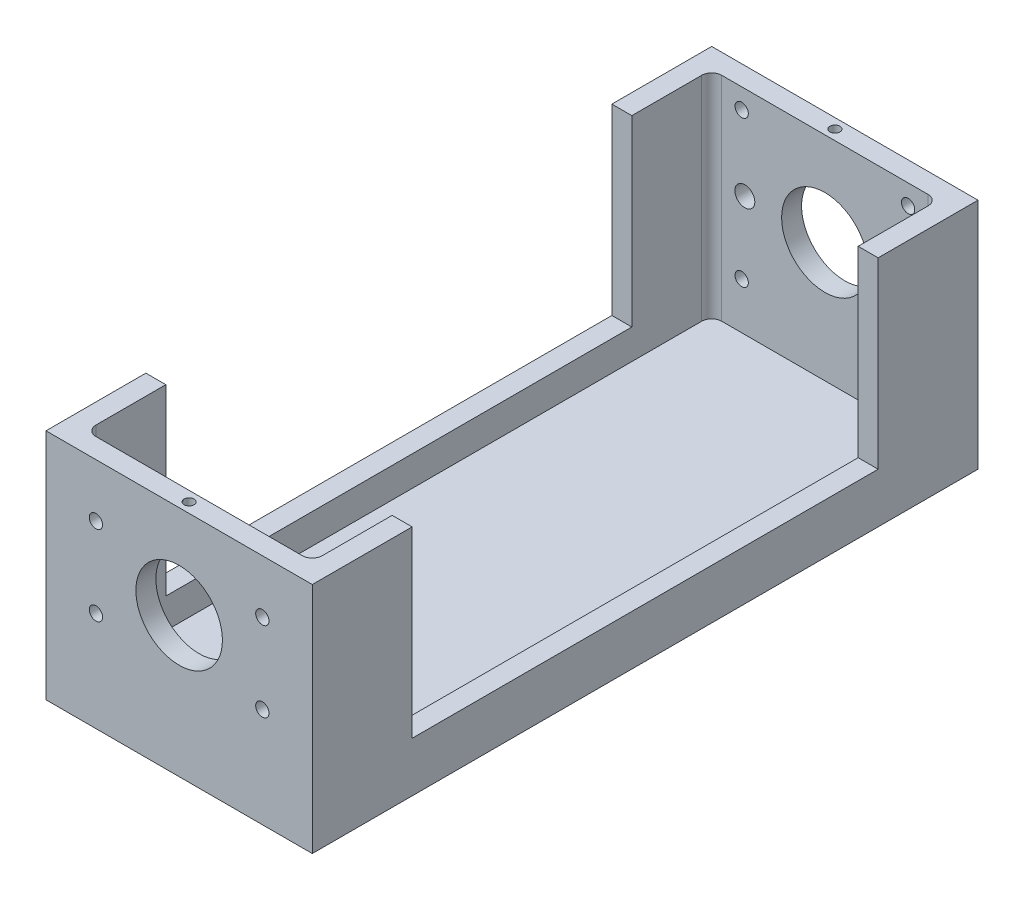
from build123d import *

# Parameters (mm, degrees)
SKETCH_1_W          = 80
SKETCH_1_H          = 70
EXTRUDE_1_DEPTH     = 200
CUT_EXTRUDE_1_DEPTH = 64
SKETCH_3_R          = 13
CUT_EXTRUDE_2_DEPTH = 207.942020866
SKETCH_4_R          = 2
SKETCH_4_W          = 27
SKETCH_4_H          = 36
CUT_EXTRUDE_3_DEPTH = 10
SKETCH_7_R          = 1.5
CUT_EXTRUDE_6_DEPTH = 10
SKETCH_8_W          = 140
SKETCH_8_H          = 55
CUT_EXTRUDE_7_DEPTH = 219.231528428
SKETCH_9_R          = 2
CUT_EXTRUDE_8_DEPTH = 6
SKETCH_10_R         = 3
SKETCH_10_R_2       = 2
CUT_EXTRUDE_9_DEPTH = 50


with BuildPart() as part:
    # 草图1 → 凸台-拉伸1 (new body)
    with BuildSketch(Plane.XY):
        Rectangle(SKETCH_1_W, SKETCH_1_H)
    extrude(amount=-EXTRUDE_1_DEPTH)

    # 草图2 → 切除-拉伸1 (cut)
    with BuildSketch(Plane(origin=(0, 35, 0), x_dir=(1, 0, 0), z_dir=(0, 1, 0))):
        with BuildLine():
            ThreePointArc((-31, 194), (-33.121320344, 193.121320344), (-34, 191))
            Line((-34, 191), (-34, 9))
            ThreePointArc((-34, 9), (-33.121320344, 6.878679656), (-31, 6))
            Line((-31, 6), (31, 6))
            ThreePointArc((31, 6), (33.121320344, 6.878679656), (34, 9))
            Line((34, 9), (34, 191))
            ThreePointArc((34, 191), (33.121320344, 193.121320344), (31, 194))
            Line((31, 194), (-31, 194))
        make_face()
    extrude(amount=-CUT_EXTRUDE_1_DEPTH, mode=Mode.SUBTRACT)

    # 草图3 → 切除-拉伸2 (cut, through all)
    with BuildSketch(Plane.XY):
        with Locations((0, 7)):
            Circle(SKETCH_3_R)
    extrude(amount=-CUT_EXTRUDE_2_DEPTH, mode=Mode.SUBTRACT)

    # 草图4 → 切除-拉伸3 (cut)
    with BuildSketch(Plane.ZY.offset(40)):
        with Locations((-121.5, 2)):
            Circle(SKETCH_4_R)
        with Locations((-121.5, 26)):
            Circle(SKETCH_4_R)
        with Locations((-158.5, 26)):
            Circle(SKETCH_4_R)
        with Locations((-158.5, 2)):
            Circle(SKETCH_4_R)
        with Locations((-140, 14)):
            Rectangle(SKETCH_4_W, SKETCH_4_H)
    extrude(amount=-CUT_EXTRUDE_3_DEPTH, mode=Mode.SUBTRACT)

    # 草图7 → 切除-拉伸6 (cut)
    with BuildSketch(Plane(origin=(0, 35, 0), x_dir=(1, 0, 0), z_dir=(0, 1, 0))):
        with Locations((-37, 150)):
            Circle(SKETCH_7_R)
        with Locations((-37, 50)):
            Circle(SKETCH_7_R)
        with Locations((37, 50)):
            Circle(SKETCH_7_R)
        with Locations((37, 150)):
            Circle(SKETCH_7_R)
        with Locations((0, 197)):
            Circle(SKETCH_7_R)
        with Locations((0, 3)):
            Circle(SKETCH_7_R)
    extrude(amount=-CUT_EXTRUDE_6_DEPTH, mode=Mode.SUBTRACT)

    # 草图8 → 切除-拉伸7 (cut, through all)
    with BuildSketch(Plane(origin=(40, 0, 0), x_dir=(0, 0, -1), z_dir=(1, 0, 0))):
        with Locations((100, 7.5)):
            Rectangle(SKETCH_8_W, SKETCH_8_H)
    extrude(amount=-CUT_EXTRUDE_7_DEPTH, mode=Mode.SUBTRACT)

    # 草图9 → 切除-拉伸8 (cut)
    with BuildSketch(Plane(origin=(0, 0, -6), x_dir=(-1, 0, 0), z_dir=(0, 0, -1))):
        with Locations((-25, -5)):
            Circle(SKETCH_9_R)
        with Locations((-25, 19)):
            Circle(SKETCH_9_R)
        with Locations((25, 19)):
            Circle(SKETCH_9_R)
        with Locations((25, -5)):
            Circle(SKETCH_9_R)
    extrude(amount=-CUT_EXTRUDE_8_DEPTH, mode=Mode.SUBTRACT)

    # 草图10 → 切除-拉伸9 (cut)
    with BuildSketch(Plane(origin=(0, 0, -204), x_dir=(-1, 0, 0), z_dir=(0, 0, -1))):
        with Locations((24.051141157, 7)):
            Circle(SKETCH_10_R)
        with Locations((25, -15)):
            Circle(SKETCH_10_R_2)
        with Locations((25, 29)):
            Circle(SKETCH_10_R_2)
        with Locations((-25, 29)):
            Circle(SKETCH_10_R_2)
        with Locations((-23.948858843, 7)):
            Circle(SKETCH_10_R)
        with Locations((-25, -15)):
            Circle(SKETCH_10_R_2)
    extrude(amount=-CUT_EXTRUDE_9_DEPTH, mode=Mode.SUBTRACT)


solid = part.part
